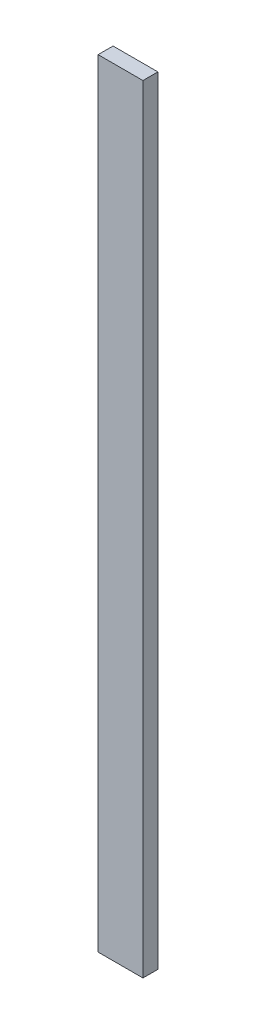
from build123d import *

# Parameters (mm, degrees)
SKETCH1_W           = 30
SKETCH1_H           = 519.999989054
BOSS_EXTRUDE1_DEPTH = 10


with BuildPart() as part:
    # Sketch1 → Boss-Extrude1 (new body)
    with BuildSketch(Plane.XY):
        with Locations((70, -271.477869656)):
            Rectangle(SKETCH1_W, SKETCH1_H)
    extrude(amount=BOSS_EXTRUDE1_DEPTH)


solid = part.part
